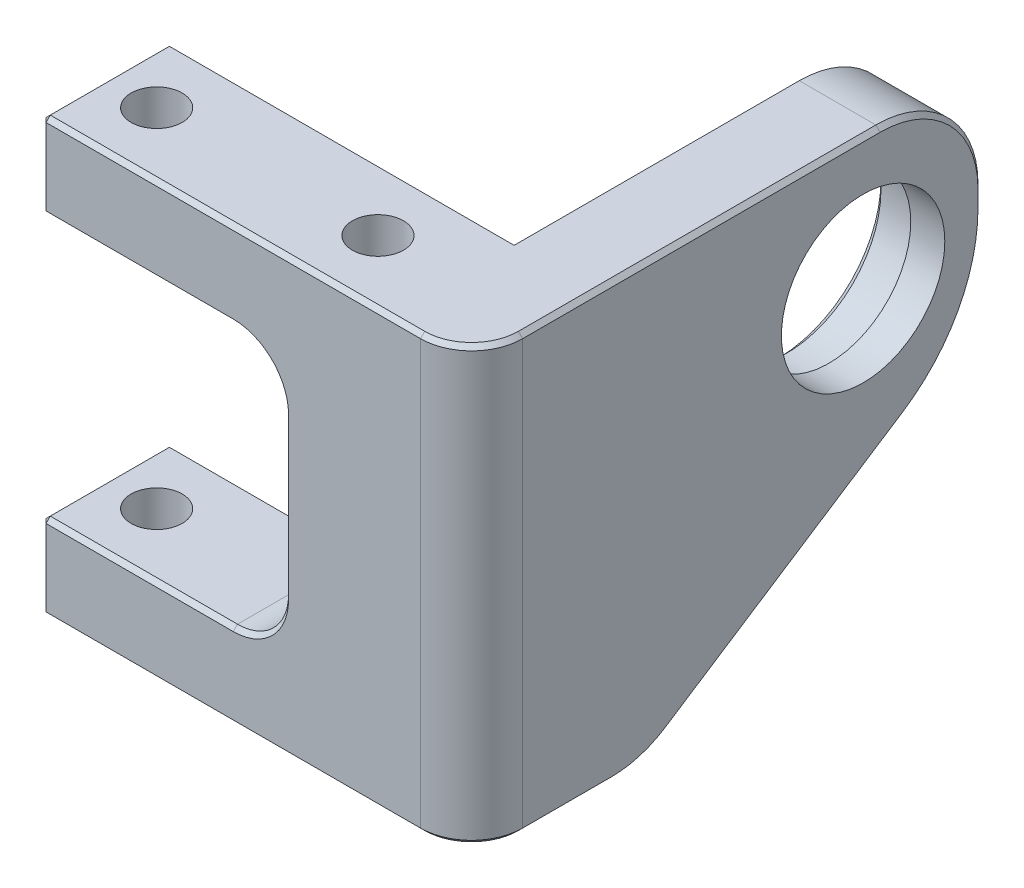
from build123d import *

# Parameters (mm, degrees)
BOSS_EXTRUDE1_DEPTH = 50.8
SKETCH3_R           = 11.1
CUT_EXTRUDE1_DEPTH  = 6
SKETCH4_R           = 9.6
CUT_EXTRUDE2_DEPTH  = 87.597575024
CUT_EXTRUDE3_DEPTH  = 84.529276305
FILLET1_R           = 20
FILLET2_R           = 12
SKETCH6_R           = 3
CUT_EXTRUDE4_DEPTH  = 89.809571556
SKETCH7_W           = 28.5
SKETCH7_H           = 30.8
CUT_EXTRUDE5_DEPTH  = 85.592493757
FILLET3_R           = 6
FILLET4_R           = 6
FILLET5_R           = 12
CHAMFER1_SIZE       = 0.5
CHAMFER2_SIZE       = 1


with BuildPart() as part:
    # Sketch2 → Boss-Extrude1 (new body)
    with BuildSketch(Plane(origin=(0, 0, 0), x_dir=(1, 0, 0), z_dir=(0, 1, 0))):
        Polygon((0, 7.5), (50.5, 7.5), (50.5, -52.5), (40.5, -52.5), (40.5, -7.5), (0, -7.5), align=None)
    extrude(amount=BOSS_EXTRUDE1_DEPTH)

    # Sketch3 → Cut-Extrude1 (cut)
    with BuildSketch(Plane.ZY.offset(-40.5)):
        with Locations((38.5, 35.4)):
            Circle(SKETCH3_R)
    extrude(amount=-CUT_EXTRUDE1_DEPTH, mode=Mode.SUBTRACT)

    # Sketch4 → Cut-Extrude2 (cut, through all)
    with BuildSketch(Plane.ZY.offset(-46.5)):
        with Locations((38.5, 35.4)):
            Circle(SKETCH4_R)
    extrude(amount=-CUT_EXTRUDE2_DEPTH, mode=Mode.SUBTRACT)

    # Sketch5 → Cut-Extrude3 (cut, through all)
    with BuildSketch(Plane.ZY.offset(-40.5)):
        Polygon((12.5, 0), (52.5, 0), (52.5, 26), align=None)
    extrude(amount=-CUT_EXTRUDE3_DEPTH, mode=Mode.SUBTRACT)

    # Fillet1
    fillet1_edges = [part.edges().sort_by_distance(p)[0] for p in [
        (45.5, 26, 52.5),
    ]]
    fillet(fillet1_edges, radius=FILLET1_R)

    # Fillet2
    fillet2_edges = [part.edges().sort_by_distance(p)[0] for p in [
        (45.5, 50.8, 52.5),
    ]]
    fillet(fillet2_edges, radius=FILLET2_R)

    # Sketch6 → Cut-Extrude4 (cut, through all)
    with BuildSketch(Plane(origin=(0, 50.8, 0), x_dir=(1, 0, 0), z_dir=(0, 1, 0))):
        with Locations((6, 0)):
            Circle(SKETCH6_R)
        with Locations((32, 0)):
            Circle(SKETCH6_R)
    extrude(amount=-CUT_EXTRUDE4_DEPTH, mode=Mode.SUBTRACT)

    # Sketch7 → Cut-Extrude5 (cut, through all)
    with BuildSketch(Plane.XY.offset(7.5)):
        with Locations((14.25, 25.4)):
            Rectangle(SKETCH7_W, SKETCH7_H)
    extrude(amount=-CUT_EXTRUDE5_DEPTH, mode=Mode.SUBTRACT)

    # Fillet3
    fillet3_edges = [part.edges().sort_by_distance(p)[0] for p in [
        (28.5, 40.8, 0),
        (28.5, 10, 0),
    ]]
    fillet(fillet3_edges, radius=FILLET3_R)

    # Fillet4
    fillet4_edges = [part.edges().sort_by_distance(p)[0] for p in [
        (50.5, 25.4, -7.5),
    ]]
    fillet(fillet4_edges, radius=FILLET4_R)

    # Fillet5
    fillet5_edges = [part.edges().sort_by_distance(p)[0] for p in [
        (45.5, 0, 12.5),
    ]]
    fillet(fillet5_edges, radius=FILLET5_R)

    # Chamfer1
    chamfer1_edges = [part.edges().sort_by_distance(p)[0] for p in [
        (11.25, 10, -7.5),
        (11.25, 40.8, -7.5),
        (26.742640687, 11.757359313, -7.5),
        (26.742640687, 39.042640687, -7.5),
        (28.5, 25.4, -7.5),
        (40.5, 50.8, 24),
        (11.25, 40.8, 7.5),
        (40.5, 47.285281374, 48.985281374),
        (26.742640687, 39.042640687, 7.5),
        (40.5, 37.826860442, 52.5),
        (28.5, 25.4, 7.5),
        (40.5, 27.314206751, 50.07832956),
        (26.742640687, 11.757359313, 7.5),
        (0, 5, 7.5),
        (40.5, 11.011762581, 29.441173202),
        (40.5, 0, 8.221359592),
        (20.25, 0, 7.5),
        (0, 0, 0),
        (11.25, 10, 7.5),
        (0, 10, 0),
        (0, 5, -7.5),
        (22.25, 0, -7.5),
        (50.5, 0, 3.721359592),
        (50.5, 11.011762581, 29.441173202),
        (50.5, 27.314206751, 50.07832956),
        (50.5, 37.826860442, 52.5),
        (50.5, 47.285281374, 48.985281374),
        (50.5, 50.8, 19.5),
        (0, 45.8, -7.5),
        (22.25, 50.8, -7.5),
        (0, 50.8, 0),
        (0, 40.8, 0),
        (0, 45.8, 7.5),
        (20.25, 50.8, 7.5),
        (48.742640687, 0, -5.742640687),
        (48.742640687, 50.8, -5.742640687),
        (50.5, 0.4948733, 12.353299725),
        (40.5, 0.4948733, 12.353299725),
    ]]
    chamfer(chamfer1_edges, length=CHAMFER1_SIZE)

    # Chamfer2
    chamfer2_edges = [part.edges().sort_by_distance(p)[0] for p in [
        (40.5, 35.4, 27.4),
    ]]
    chamfer(chamfer2_edges, length=CHAMFER2_SIZE)


with BuildPart() as body_2:
    # Mirror1: mirrored copy
    add(part.part.mirror(Plane(origin=(0, 50.8, -7.5), x_dir=(1, 0, 0), z_dir=(0, 0, -1))))


solid = body_2.part
